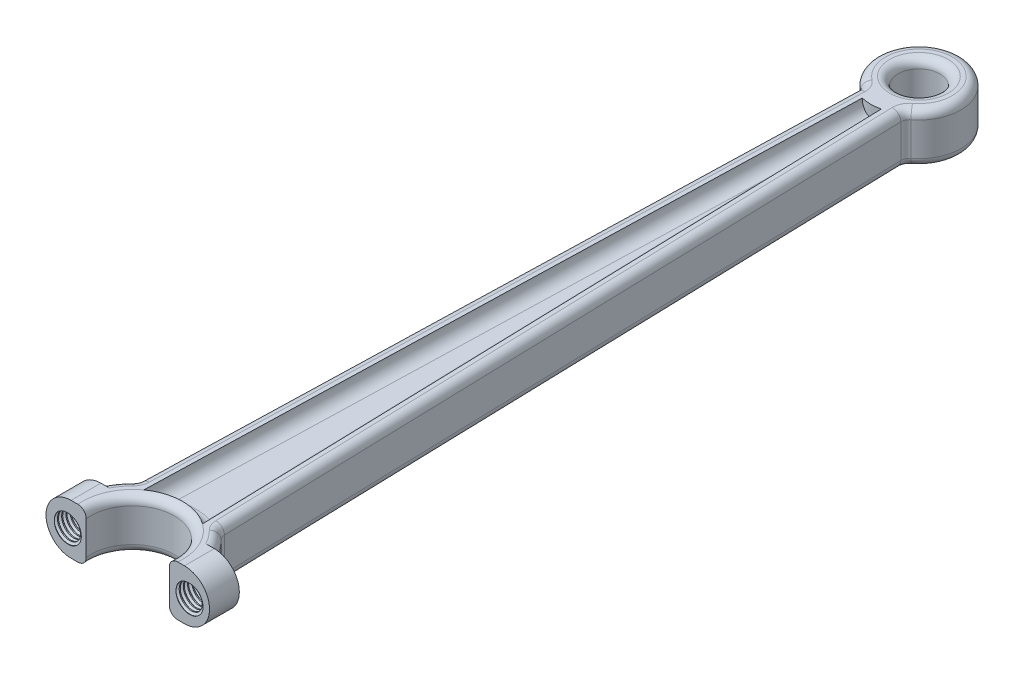
from build123d import *

# Parameters (mm, degrees)
BOSS_EXTRUDE1_OUTLINE_R   = 10
BOSS_EXTRUDE1_OUTLINE_R_2 = 5
BOSS_EXTRUDE1_DEPTH       = 12
CUT_EXTRUDE1_DEPTH        = 3
FILLET1_R                 = 3
CUT_EXTRUDE2_DEPTH        = 3
FILLET2_R                 = 3
FILLET3_R                 = 2
CUT_EXTRUDE3_DEPTH        = 211.524788724
SKETCH5_R                 = 3
CUT_EXTRUDE4_DEPTH        = 15
THREAD1_PITCH             = 1
THREAD2_PITCH             = 1
SKETCH7_R                 = 4
CUT_EXTRUDE6_DEPTH        = 10
SKETCH8_W                 = 40
SKETCH8_H                 = 15
CUT_EXTRUDE8_DEPTH        = 205.392023956


# Read off the part's stored shape, not the designer's step: Boss-Extrude1
# Some blends are built 0.0001 mm under size
with BuildPart() as part:
    # Boss-Extrude1 outline → Boss-Extrude1 (new body)
    with BuildSketch(Plane(origin=(0, 0, 0), x_dir=(1, 0, 0), z_dir=(0, 1, 0))):
        with BuildLine():
            Line((10.057337507, -199.228789793), (19.999995267, -199.228789793))
            Line((19.999995267, -199.228789793), (19.999995267, -182.099999147))
            Line((19.999995267, -182.099999147), (13.747726713, -182.099999147))
            ThreePointArc((13.747726713, -182.099999147), (12.150957531, -179.304874585), (9.994575022, -176.914810233))
            Line((9.994575022, -176.914810233), (5.240445326, -8.51690864))
            ThreePointArc((5.240445326, -8.51690864), (-2.3e-08, 10), (-5.240445288, -8.516908664))
            Line((-5.240445288, -8.516908664), (-9.994574202, -176.9148095))
            ThreePointArc((-9.994574202, -176.9148095), (-12.150957209, -179.30487414), (-13.747726713, -182.099999147))
            Line((-13.747726713, -182.099999147), (-20.000004562, -182.099999147))
            Line((-20.000004562, -182.099999147), (-20.000004169, -199.228789793))
            Line((-20.000004169, -199.228789793), (-10.057337507, -199.228789793))
            ThreePointArc((-10.057337507, -199.228789793), (0, -203.1), (10.057337507, -199.228789793))
        make_face()
        with Locations((0, -188.1)):
            Circle(BOSS_EXTRUDE1_OUTLINE_R, mode=Mode.SUBTRACT)
        Circle(BOSS_EXTRUDE1_OUTLINE_R_2, mode=Mode.SUBTRACT)
    extrude(amount=BOSS_EXTRUDE1_DEPTH)

    # Sketch2 → Cut-Extrude1 (cut)
    with BuildSketch(Plane(origin=(0, 12, 0), x_dir=(1, 0, 0), z_dir=(0, 1, 0))):
        with BuildLine():
            ThreePointArc((-2.278251808, -11.287020525), (2.3e-08, -11.55), (2.278251852, -11.287020514))
            Line((2.278251852, -11.287020514), (7.035026857, -178.378457061))
            ThreePointArc((7.035026857, -178.378457061), (5.07e-07, -176.1), (-7.035026035, -178.378456466))
            Line((-7.035026035, -178.378456466), (-2.278251808, -11.287020525))
        make_face()
    extrude(amount=-CUT_EXTRUDE1_DEPTH, mode=Mode.SUBTRACT)

    # Fillet1
    # the kernel refuses this fillet: 3 mm, written as the material it adds along each edge
    with BuildSketch(Plane(origin=(2.0648276, 9, 3.79005779), x_dir=(0, 1, 0), z_dir=(0.028456566963708428, 0, 0.9995950298979283))) as fillet1_piece_1_section:
        with BuildLine():
            CenterArc((FILLET1_R, FILLET1_R), FILLET1_R, 180, 90)
            Line((0, FILLET1_R), (0, 0))
            Line((0, 0), (FILLET1_R, 0))
        make_face()
    fillet1_piece_1 = extrude(amount=182.159130997, mode=Mode.PRIVATE)
    fillet1_piece_1 = fillet1_piece_1 - Plane(origin=(0, 9.670953065, 1.55), x_dir=(-0.22782518084005282, 0, 0.9737020524653305), z_dir=(0, 1, 0)) * Cylinder(10, 377, mode=Mode.PRIVATE)
    fillet1_piece_1 = fillet1_piece_1 - Plane(origin=(0, 9.670953065, 188.1), x_dir=(0.5862522380999335, 0, -0.8101285782657089), z_dir=(0, 1, 0)) * Cylinder(12, 377, mode=Mode.PRIVATE)
    with BuildSketch(Plane(origin=(0, 9, 188.1), x_dir=(0.9494830945211188, 0, -0.3138181849711712), z_dir=(0.3138181849711712, 0, 0.9494830945211188))) as fillet1_piece_2:
        with BuildLine():
            CenterArc((12 + FILLET1_R, FILLET1_R), FILLET1_R, 180, 90)
            Line((12 + FILLET1_R, 0), (12, 0))
            Line((12, 0), (12, FILLET1_R))
        make_face()
    fillet1_piece_2_solid = revolve(axis=Axis((0, 9, 188.1), (0, 1, 0)), revolution_arc=143.421028275, mode=Mode.PRIVATE)
    with BuildSketch(Plane(origin=(-7.248450253, 9, 185.875419191), x_dir=(0, 1, 0), z_dir=(0.028456562416706865, 0, -0.9995950300273727))) as fillet1_piece_3_section:
        with BuildLine():
            CenterArc((FILLET1_R, FILLET1_R), FILLET1_R, 180, 90)
            Line((0, FILLET1_R), (0, 0))
            Line((0, 0), (FILLET1_R, 0))
        make_face()
    fillet1_piece_3 = extrude(amount=182.15913037, mode=Mode.PRIVATE)
    fillet1_piece_3 = fillet1_piece_3 - Plane(origin=(0, 9.670954356, 1.55), x_dir=(-0.22782518084005282, 0, 0.9737020524653305), z_dir=(0, 1, 0)) * Cylinder(10, 377, mode=Mode.PRIVATE)
    fillet1_piece_3 = fillet1_piece_3 - Plane(origin=(0, 9.670954356, 188.1), x_dir=(0.5862522380999335, 0, -0.8101285782657089), z_dir=(0, 1, 0)) * Cylinder(12, 377, mode=Mode.PRIVATE)
    add([fillet1_piece_1, fillet1_piece_2_solid, fillet1_piece_3])

    # Sketch3 → Cut-Extrude2 (cut)
    with BuildSketch(Plane.XZ):
        with BuildLine():
            ThreePointArc((-1.807497589, 6.762614322), (0.201612134, 6.997096008), (2.193887229, 6.647319672))
            Line((2.193887229, 6.647319672), (7.034632618, 178.37817178))
            ThreePointArc((7.034632618, 178.37817178), (-0.001986384, 176.100000164), (-7.037850779, 178.380501227))
            Line((-7.037850779, 178.380501227), (-1.807497589, 6.762614322))
        make_face()
    extrude(amount=-CUT_EXTRUDE2_DEPTH, mode=Mode.SUBTRACT)

    # Fillet2
    # the kernel refuses this fillet: 3 mm, written as the material it adds along each edge
    with BuildSketch(Plane(origin=(1.982561337, 3, -0.849702494), x_dir=(0, -1, 0), z_dir=(0.028176785581951365, 0, 0.9996029555549888))) as fillet2_piece_1_section:
        with BuildLine():
            CenterArc((FILLET2_R, -FILLET2_R), FILLET2_R, 90, 90)
            Line((0, -FILLET2_R), (0, 0))
            Line((0, 0), (FILLET2_R, 0))
        make_face()
    fillet2_piece_1 = extrude(amount=186.799063972, mode=Mode.PRIVATE)
    fillet2_piece_1 = fillet2_piece_1 - Plane(origin=(0, 2.319656872, 0), x_dir=(-0.2582139413164745, 0, 0.9660877602525624), z_dir=(0, -1, 0)) * Cylinder(7, 386, mode=Mode.PRIVATE)
    fillet2_piece_1 = fillet2_piece_1 - Plane(origin=(0, 2.319656872, 188.1), x_dir=(0.5862193848008117, 0, -0.810152351649835), z_dir=(0, -1, 0)) * Cylinder(12, 386, mode=Mode.PRIVATE)
    add(fillet2_piece_1)
    with BuildSketch(Plane(origin=(-7.266320226, 3, 185.877020533), x_dir=(0, -1, 0), z_dir=(0.030462592897509376, 0, -0.9995359075260681))) as fillet2_piece_2_section:
        with BuildLine():
            CenterArc((FILLET2_R, -FILLET2_R), FILLET2_R, 90, 90)
            Line((0, -FILLET2_R), (0, 0))
            Line((0, 0), (FILLET2_R, 0))
        make_face()
    fillet2_piece_2 = extrude(amount=186.697570455, mode=Mode.PRIVATE)
    fillet2_piece_2 = fillet2_piece_2 - Plane(origin=(0, 2.319736993, 0), x_dir=(-0.2582139413164745, 0, 0.9660877602525624), z_dir=(0, -1, 0)) * Cylinder(7, 386, mode=Mode.PRIVATE)
    fillet2_piece_2 = fillet2_piece_2 - Plane(origin=(0, 2.319736993, 188.1), x_dir=(0.5862193848008117, 0, -0.810152351649835), z_dir=(0, -1, 0)) * Cylinder(12, 386, mode=Mode.PRIVATE)
    add(fillet2_piece_2)
    with BuildSketch(Plane(origin=(0, 3, 188.1), x_dir=(0.9494703876108618, 0, -0.31385662817611465), z_dir=(0.31385662817611465, 0, 0.9494703876108618))) as fillet2_piece_3:
        with BuildLine():
            CenterArc((12 + FILLET2_R, -FILLET2_R), FILLET2_R, 90, 90)
            Line((12 + FILLET2_R, 0), (12, 0))
            Line((12, 0), (12, -FILLET2_R))
        make_face()
    revolve(axis=Axis((0, 3, 188.1), (0, 1, 0)), revolution_arc=143.435362011)

    # Fillet3
    fillet3_edges = [part.edges().sort_by_distance(p)[0] for p in [
        (-5, 0, 0),
        (12.150957531, 12, 179.304874585),
        (-10, 0, 188.1),
        (-12.150957209, 0, 179.30487414),
        (7.617510174, 12, 92.715859436),
        (-7.617509745, 0, 92.715859082),
        (-2.3e-08, 0, -10),
        (7.617510174, 0, 92.715859436),
        (12.150957531, 0, 179.304874585),
        (-2.3e-08, 12, -10),
        (-9.994574202, 6, 176.9148095),
        (-5.240445288, 6, 8.516908664),
        (5.240445326, 6, 8.51690864),
        (9.994575022, 6, 176.914810233),
        (-7.617509745, 12, 92.715859082),
        (-12.150957209, 12, 179.30487414),
        (-10, 12, 188.1),
        (-5, 12, 0),
    ]]
    fillet(fillet3_edges, radius=FILLET3_R - 0.0001)  # a hair under: the kernel refuses the full size

    # Sketch4 → Cut-Extrude3 (cut, through all)
    with BuildSketch(Plane.XY.offset(199.228789793)):
        with BuildLine():
            Line((-19.557337507, 12), (-20.000004424, 12))
            Line((-20.000004424, 12), (-20.000004424, 0))
            Line((-20.000004424, 0), (-19.557337507, 0))
            Line((-19.557337507, 0), (-13.557337507, 0))
            ThreePointArc((-13.557337507, 0), (-19.557337507, 6), (-13.557337507, 12))
            Line((-13.557337507, 12), (-19.557337507, 12))
        make_face()
        with BuildLine():
            Line((19.557337507, 12), (13.557337507, 12))
            ThreePointArc((13.557337507, 12), (17.799978194, 10.242640687), (19.557337507, 6))
            ThreePointArc((19.557337507, 6), (17.799978194, 1.757359313), (13.557337507, 0))
            Line((13.557337507, 0), (19.557337507, 0))
            Line((19.557337507, 0), (19.999995267, 0))
            Line((19.999995267, 0), (19.999995267, 12))
            Line((19.999995267, 12), (19.557337507, 12))
        make_face()
    extrude(amount=-CUT_EXTRUDE3_DEPTH, mode=Mode.SUBTRACT)

    # Sketch5 → Cut-Extrude4 (cut)
    with BuildSketch(Plane.XY.offset(199.228789793)):
        with Locations((-14.557337507, 6)):
            Circle(SKETCH5_R)
        with Locations((14.557337507, 6)):
            Circle(SKETCH5_R)
    extrude(amount=-CUT_EXTRUDE4_DEPTH, mode=Mode.SUBTRACT)

    # Thread1: the profile of Thread Profile1 profile screwed along a right-hand helix of 15 turns, 8 arcs to a turn; built about Z, then put on its axis
    thread1_z = Axis((0, 0, 0), (0, 0, 1))
    thread1_corners = [(2.9997, 0, -0.000173205), (3.541265875, 0, 0.312499998), (3.541265875, 0, 0.437499998), (2.9997, 0, 0.750173202)]
    with BuildLine(mode=Mode.PRIVATE) as thread1_profile:
        Line(thread1_corners[0], thread1_corners[1])
        Line(thread1_corners[1], thread1_corners[2])
        Line(thread1_corners[2], thread1_corners[3])
        Line(thread1_corners[3], thread1_corners[0])
    thread1_cap = Face(thread1_profile.wire())
    thread1_turn_angles = [0, 22.5, 45, 67.5, 90, 112.5, 135, 157.5, 180, 202.5, 225, 247.5, 270, 292.5, 315, 337.5, 360]
    thread1_turn_weights = [1, 0.9238795325112867, 1, 0.9238795325112867, 1, 0.9238795325112867, 1, 0.9238795325112867, 1, 0.9238795325112867, 1, 0.9238795325112867, 1, 0.9238795325112867, 1, 0.9238795325112867, 1]
    thread1_turn_rails = [Edge.make_bspline([Vector(p[0], p[1], 0).rotate(thread1_z, thread1_turn_angles[k]) / thread1_turn_weights[k] + Vector(0, 0, p[2] + THREAD1_PITCH * thread1_turn_angles[k] / 360) for k in range(17)], [0, 0, 0, 1, 1, 2, 2, 3, 3, 4, 4, 5, 5, 6, 6, 7, 7, 8, 8, 8], 2, thread1_turn_weights) for p in thread1_corners]
    thread1_turn_sides = [Face.make_surface_from_curves(thread1_turn_rails[p[0]], thread1_turn_rails[p[1]]) for p in [(0, 1), (1, 2), (2, 3), (3, 0)]]
    thread1 = Plane(origin=(14.557337507, 6, 200.228789793), x_dir=(-1, 0, 0), z_dir=(0, 0, -1)) * Solid(Shell([*[p.moved(Location((0, 0, THREAD1_PITCH * i))) for i in range(15) for p in thread1_turn_sides], thread1_cap, thread1_cap.rotate(thread1_z, 5400).moved(Location((0, 0, THREAD1_PITCH * 5400 / 360)))]))
    add(thread1, mode=Mode.SUBTRACT)

    # Thread2: the profile of Thread Profile2 profile screwed along a right-hand helix of 15 turns, 8 arcs to a turn; built about Z, then put on its axis
    thread2_z = Axis((0, 0, 0), (0, 0, 1))
    thread2_corners = [(2.9997, 0, -0.000173205), (3.541265875, 0, 0.312499998), (3.541265875, 0, 0.437499998), (2.9997, 0, 0.750173202)]
    with BuildLine(mode=Mode.PRIVATE) as thread2_profile:
        Line(thread2_corners[0], thread2_corners[1])
        Line(thread2_corners[1], thread2_corners[2])
        Line(thread2_corners[2], thread2_corners[3])
        Line(thread2_corners[3], thread2_corners[0])
    thread2_cap = Face(thread2_profile.wire())
    thread2_turn_angles = [0, 22.5, 45, 67.5, 90, 112.5, 135, 157.5, 180, 202.5, 225, 247.5, 270, 292.5, 315, 337.5, 360]
    thread2_turn_weights = [1, 0.9238795325112867, 1, 0.9238795325112867, 1, 0.9238795325112867, 1, 0.9238795325112867, 1, 0.9238795325112867, 1, 0.9238795325112867, 1, 0.9238795325112867, 1, 0.9238795325112867, 1]
    thread2_turn_rails = [Edge.make_bspline([Vector(p[0], p[1], 0).rotate(thread2_z, thread2_turn_angles[k]) / thread2_turn_weights[k] + Vector(0, 0, p[2] + THREAD2_PITCH * thread2_turn_angles[k] / 360) for k in range(17)], [0, 0, 0, 1, 1, 2, 2, 3, 3, 4, 4, 5, 5, 6, 6, 7, 7, 8, 8, 8], 2, thread2_turn_weights) for p in thread2_corners]
    thread2_turn_sides = [Face.make_surface_from_curves(thread2_turn_rails[p[0]], thread2_turn_rails[p[1]]) for p in [(0, 1), (1, 2), (2, 3), (3, 0)]]
    thread2 = Plane(origin=(-14.557337507, 6, 200.228789793), x_dir=(-1, 0, 0), z_dir=(0, 0, -1)) * Solid(Shell([*[p.moved(Location((0, 0, THREAD2_PITCH * i))) for i in range(15) for p in thread2_turn_sides], thread2_cap, thread2_cap.rotate(thread2_z, 5400).moved(Location((0, 0, THREAD2_PITCH * 5400 / 360)))]))
    add(thread2, mode=Mode.SUBTRACT)

    # Sketch7 → Cut-Extrude6 (cut)
    with BuildSketch(Plane.XY.offset(199.228789793)):
        with Locations((-14.557337507, 6)):
            Circle(SKETCH7_R)
        with Locations((14.557337507, 6)):
            Circle(SKETCH7_R)
    extrude(amount=-CUT_EXTRUDE6_DEPTH, mode=Mode.SUBTRACT)

    # Sketch8 → Cut-Extrude8 (cut, through all)
    with BuildSketch(Plane.XZ):
        with Locations((0.057337507, 196.728789793)):
            Rectangle(SKETCH8_W, SKETCH8_H)
    extrude(amount=-CUT_EXTRUDE8_DEPTH, mode=Mode.SUBTRACT)


solid = part.part
